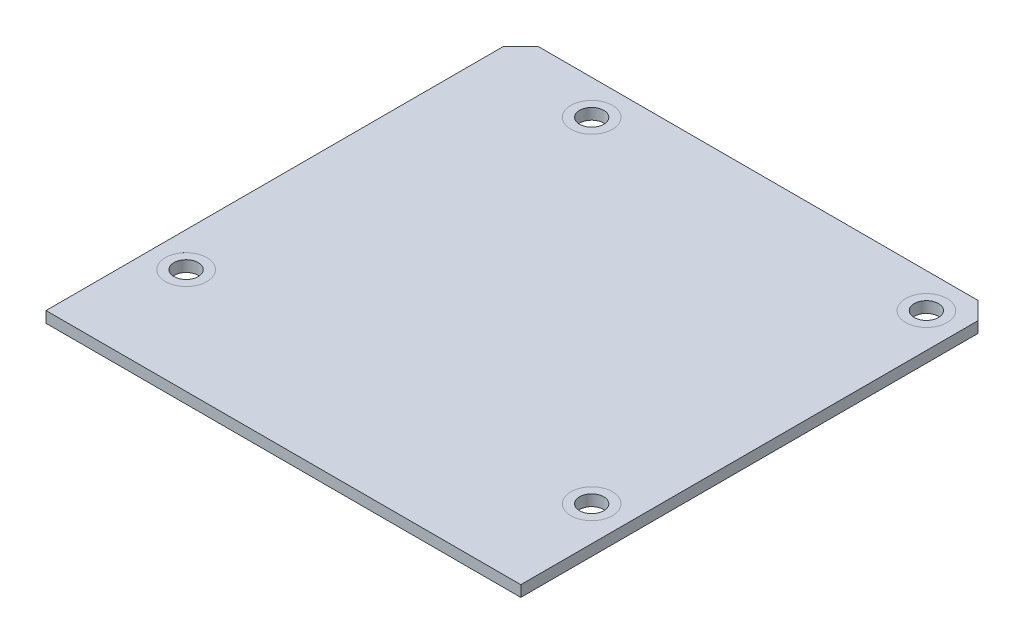
from build123d import *

# Parameters (mm, degrees)
SKETCH1_W           = 68.58
SKETCH1_H           = 68.58
BOSS_EXTRUDE1_DEPTH = 1.6
CHAMFER1_SIZE       = 2.54
CUT_EXTRUDE1_REACH  = 50.52
SKETCH2_R           = 1.75
SKETCH3_R           = 3
CUT_EXTRUDE2_DEPTH  = 0.0001


with BuildPart() as part:
    # Sketch1 → Boss-Extrude1 (new body)
    with BuildSketch(Plane(origin=(0, 0, 0), x_dir=(1, 0, 0), z_dir=(0, 1, 0))):
        Rectangle(SKETCH1_W, SKETCH1_H)
    extrude(amount=BOSS_EXTRUDE1_DEPTH)

    # Chamfer1
    chamfer1_edges = [part.edges().sort_by_distance(p)[0] for p in [
        (34.29, 0.8, -34.29),
        (-34.29, 0.8, -34.29),
    ]]
    chamfer(chamfer1_edges, length=CHAMFER1_SIZE)

    # Sketch2 → Cut-Extrude1 (cut, up to next)
    with BuildSketch(Plane(origin=(0, 1.6, 0), x_dir=(1, 0, 0), z_dir=(0, 1, 0)), mode=Mode.PRIVATE) as cut_extrude1_sk1:
        with Locations((-19.05, 29.29)):
            Circle(SKETCH2_R)
    cut_extrude1_tool1 = extrude(cut_extrude1_sk1.sketch, amount=-CUT_EXTRUDE1_REACH, mode=Mode.PRIVATE) & part.part
    # Sketch2 → Cut-Extrude1 (cut, up to next)
    with BuildSketch(Plane(origin=(0, 1.6, 0), x_dir=(1, 0, 0), z_dir=(0, 1, 0)), mode=Mode.PRIVATE) as cut_extrude1_sk2:
        with Locations((29.29, 29.29)):
            Circle(SKETCH2_R)
    cut_extrude1_tool2 = extrude(cut_extrude1_sk2.sketch, amount=-CUT_EXTRUDE1_REACH, mode=Mode.PRIVATE) & part.part
    # Sketch2 → Cut-Extrude1 (cut, up to next)
    with BuildSketch(Plane(origin=(0, 1.6, 0), x_dir=(1, 0, 0), z_dir=(0, 1, 0)), mode=Mode.PRIVATE) as cut_extrude1_sk3:
        with Locations((29.29, -19.05)):
            Circle(SKETCH2_R)
    cut_extrude1_tool3 = extrude(cut_extrude1_sk3.sketch, amount=-CUT_EXTRUDE1_REACH, mode=Mode.PRIVATE) & part.part
    # Sketch2 → Cut-Extrude1 (cut, up to next)
    with BuildSketch(Plane(origin=(0, 1.6, 0), x_dir=(1, 0, 0), z_dir=(0, 1, 0)), mode=Mode.PRIVATE) as cut_extrude1_sk4:
        with Locations((-29.29, -19.05)):
            Circle(SKETCH2_R)
    cut_extrude1_tool4 = extrude(cut_extrude1_sk4.sketch, amount=-CUT_EXTRUDE1_REACH, mode=Mode.PRIVATE) & part.part
    add(cut_extrude1_tool1.solids().sort_by_distance((-19.05, 1.6, -29.29))[0], mode=Mode.SUBTRACT)
    add(cut_extrude1_tool2.solids().sort_by_distance((29.29, 1.6, -29.29))[0], mode=Mode.SUBTRACT)
    add(cut_extrude1_tool3.solids().sort_by_distance((29.29, 1.6, 19.05))[0], mode=Mode.SUBTRACT)
    add(cut_extrude1_tool4.solids().sort_by_distance((-29.29, 1.6, 19.05))[0], mode=Mode.SUBTRACT)

    # Sketch3 → Cut-Extrude2 (cut)
    with BuildSketch(Plane(origin=(0, 1.6, 0), x_dir=(1, 0, 0), z_dir=(0, 1, 0))):
        with Locations((-19.05, 29.29)):
            Circle(SKETCH3_R)
        with Locations((29.29, 29.29)):
            Circle(SKETCH3_R)
        with Locations((-29.29, -19.05)):
            Circle(SKETCH3_R)
        with Locations((29.29, -19.05)):
            Circle(SKETCH3_R)
    extrude(amount=-CUT_EXTRUDE2_DEPTH, mode=Mode.SUBTRACT)


solid = part.part
